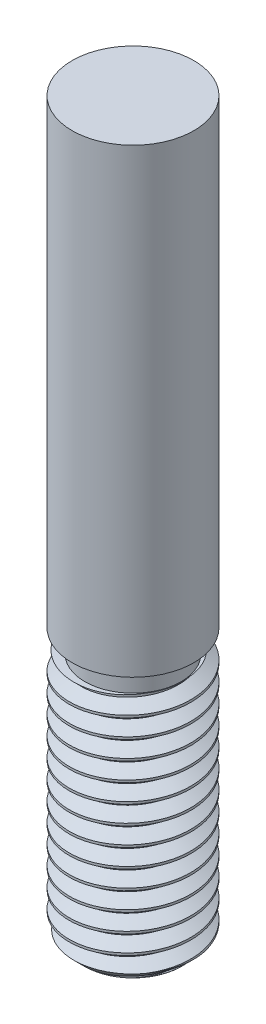
from build123d import *

# Parameters (mm, degrees)
SKETCH2_W     = 6.35
SKETCH2_H     = 76.2
END_SIZE      = 1.27
THREADS_PITCH = 1.953846154
SKETCH12_W    = 2.667
SKETCH12_H    = 2.38125


with BuildPart() as part:
    # Sketch2 → Shaft (revolve)
    with BuildSketch(Plane.XY, mode=Mode.PRIVATE) as shaft_sk:
        with Locations((3.175, -39.6875)):
            Rectangle(SKETCH2_W, SKETCH2_H)
    revolve(shaft_sk.sketch.rotate(Axis((0, -1.5875, 0), (0, -1, 0)), 180), axis=Axis((0, -1.5875, 0), (0, -1, 0)))

    # End
    end_edges = [part.edges().sort_by_distance(p)[0] for p in [
        (6.35, -77.7875, 0),
    ]]
    chamfer(end_edges, length=END_SIZE)

    # Threads: the profile of Sketch11 screwed along a right-hand helix of 14 turns, 10 arcs to a turn; built about Z, then put on its axis
    threads_z = Axis((0, 0, 0), (0, 0, 1))
    threads_corners = [(6.35, 0, -0.976923077), (6.944010107, 0, -0.976923077), (6.944010107, 0, 0.733234842), (6.35, 0, 0.733234842), (5.08, 0, 0), (5.08, 0, -0.243688235)]
    with BuildLine(mode=Mode.PRIVATE) as threads_profile:
        Line(threads_corners[0], threads_corners[1])
        Line(threads_corners[1], threads_corners[2])
        Line(threads_corners[2], threads_corners[3])
        Line(threads_corners[3], threads_corners[4])
        Line(threads_corners[4], threads_corners[5])
        Line(threads_corners[5], threads_corners[0])
    threads_cap = Face(threads_profile.wire())
    threads_turn_angles = [0, 18, 36, 54, 72, 90, 108, 126, 144, 162, 180, 198, 216, 234, 252, 270, 288, 306, 324, 342, 360]
    threads_turn_weights = [1, 0.9510565162951535, 1, 0.9510565162951535, 1, 0.9510565162951535, 1, 0.9510565162951535, 1, 0.9510565162951535, 1, 0.9510565162951535, 1, 0.9510565162951535, 1, 0.9510565162951535, 1, 0.9510565162951535, 1, 0.9510565162951535, 1]
    threads_turn_rails = [Edge.make_bspline([Vector(p[0], p[1], 0).rotate(threads_z, threads_turn_angles[k]) / threads_turn_weights[k] + Vector(0, 0, p[2] + THREADS_PITCH * threads_turn_angles[k] / 360) for k in range(21)], [0, 0, 0, 1, 1, 2, 2, 3, 3, 4, 4, 5, 5, 6, 6, 7, 7, 8, 8, 9, 9, 10, 10, 10], 2, threads_turn_weights) for p in threads_corners]
    threads_turn_sides = [Face.make_surface_from_curves(threads_turn_rails[p[0]], threads_turn_rails[p[1]]) for p in [(0, 1), (1, 2), (2, 3), (3, 4), (4, 5), (5, 0)]]
    threads = Plane(origin=(0, -77.7875, 0), x_dir=(0, 0, 1), z_dir=(0, 1, 0)) * Solid(Shell([*[p.moved(Location((0, 0, THREADS_PITCH * i))) for i in range(14) for p in threads_turn_sides], threads_cap, threads_cap.rotate(threads_z, 5040).moved(Location((0, 0, THREADS_PITCH * 5040 / 360)))]))
    add(threads, mode=Mode.SUBTRACT)

    # Sketch12 → Inset (revolve, cut)
    with BuildSketch(Plane.ZY, mode=Mode.PRIVATE) as inset_sk:
        with Locations((6.35, -50.891044004)):
            Rectangle(SKETCH12_W, SKETCH12_H)
    revolve(inset_sk.sketch.rotate(Axis((0, -1.5875, 0), (0, 1, 0)), 270), axis=Axis((0, -1.5875, 0), (0, 1, 0)), mode=Mode.SUBTRACT)


solid = part.part
